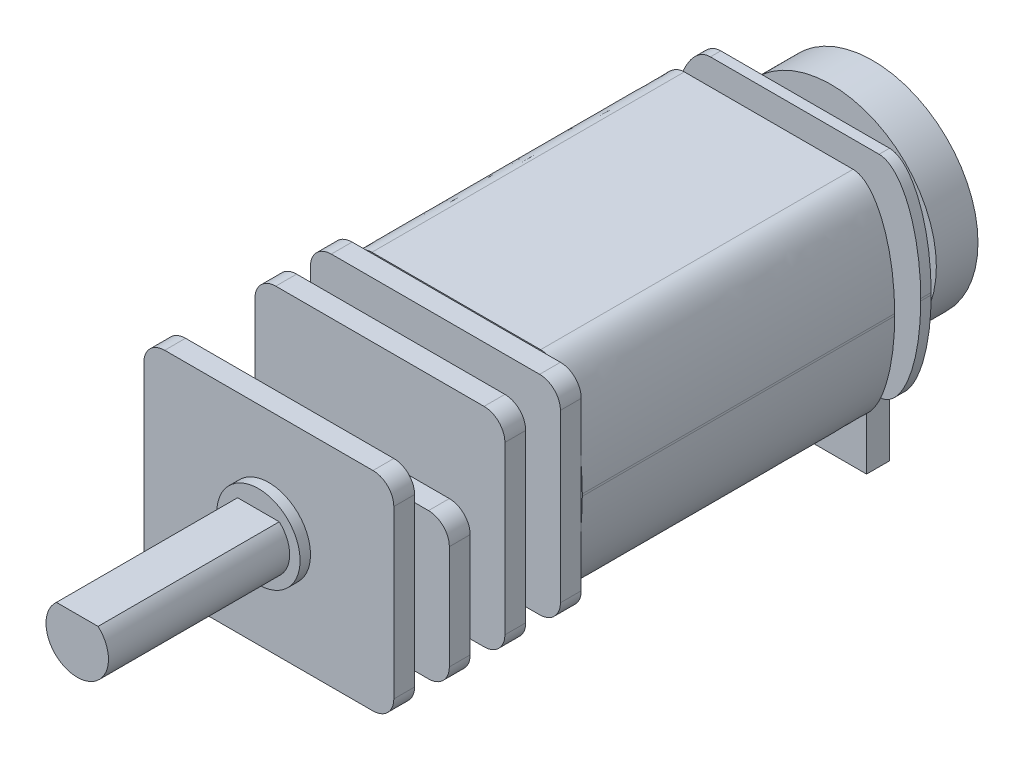
from build123d import *

# Parameters (mm, degrees)
BOSS_EXTRUDE1_DEPTH = 8.7
BOSS_EXTRUDE3_START = 8.7
SKETCH1_3_R         = 0.5
BOSS_EXTRUDE3_DEPTH = 38.2
SKETCH2_3_W         = 0.5
SKETCH2_3_H         = 10.1
BOSS_EXTRUDE4_DEPTH = 6.05
FILLET2_SIZE        = 5
FILLET2_SIZE_2      = 2
SKETCH2_W           = 1
SKETCH2_H           = 10
SKETCH2_H_2         = 7
BOSS_EXTRUDE2_DEPTH = 6
FILLET1_R           = 1
SKETCH2_5_W         = 2
SKETCH2_5_H         = 5.05
SKETCH3_R           = 2
BOSS_EXTRUDE5_DEPTH = 0.5
SKETCH4_W           = 8
SKETCH4_H           = 2.95
SKETCH4_H_2         = 1.05
BOSS_EXTRUDE6_DEPTH = 0.55


with BuildPart() as part:
    # Sketch1 → Boss-Extrude1 (new body)
    with BuildSketch(Plane.XY):
        with BuildLine():
            Line((1, 1.118033989), (-1, 1.118033989))
            ThreePointArc((-1, 1.118033989), (0, -1.5), (1, 1.118033989))
        make_face()
    extrude(amount=BOSS_EXTRUDE1_DEPTH)

    # Sketch1<3> → Boss-Extrude3 (add)
    with BuildSketch(Plane.XY.offset(BOSS_EXTRUDE3_START)):
        Circle(SKETCH1_3_R)
    extrude(amount=-BOSS_EXTRUDE3_DEPTH)

    # Sketch2<3> → Boss-Extrude4 (add, symmetric)
    with BuildSketch(Plane(origin=(0, 0, 0), x_dir=(0, 0, -1), z_dir=(1, 0, 0))):
        Polygon((9.5, 5.05), (9.5, 5), (9.5, -5), (9.5, -5.05), (24.5, -5.05), (24.5, 0), (24.5, 5.05), align=None)
        with Locations((26, 0)):
            Rectangle(SKETCH2_3_W, SKETCH2_3_H)
    extrude(amount=BOSS_EXTRUDE4_DEPTH, both=True)

    # Fillet2
    # an asymmetric fillet: 5, 2 mm, written as the material it takes off along each edge
    with BuildSketch(Plane(origin=(-6.05, -5.05, 3), x_dir=(0, 1, 0), z_dir=(0, 0, -1)), Plane(origin=(-6.05, 5.05, -37), x_dir=(0, -1, 0), z_dir=(0, 0, 1))) as fillet2_piece_1:
        with BuildLine():
            Bezier((FILLET2_SIZE, 0), (0, 0), (0, FILLET2_SIZE_2), weights=[1, 0.707106781, 1])
            Line((0, FILLET2_SIZE_2), (0, 0))
            Line((0, 0), (FILLET2_SIZE, 0))
        make_face()
    extrude(amount=40, mode=Mode.SUBTRACT)
    with BuildSketch(Plane(origin=(6.05, -5.05, 3), x_dir=(-1, 0, 0), z_dir=(0, 0, -1)), Plane(origin=(6.05, 5.05, -37), x_dir=(-1, 0, 0), z_dir=(0, 0, 1))) as fillet2_piece_2:
        with BuildLine():
            Bezier((FILLET2_SIZE_2, 0), (0, 0), (0, FILLET2_SIZE), weights=[1, 0.707106781, 1])
            Line((0, FILLET2_SIZE), (0, 0))
            Line((0, 0), (FILLET2_SIZE_2, 0))
        make_face()
    extrude(amount=40, mode=Mode.SUBTRACT)
    with BuildSketch(Plane(origin=(-6.05, -5.05, -13.25), x_dir=(0, 1, 0), z_dir=(0, 0, -1)), Plane(origin=(-6.05, 5.05, -38.75), x_dir=(0, -1, 0), z_dir=(0, 0, 1))) as fillet2_piece_3:
        with BuildLine():
            Bezier((FILLET2_SIZE, 0), (0, 0), (0, FILLET2_SIZE_2), weights=[1, 0.707106781, 1])
            Line((0, FILLET2_SIZE_2), (0, 0))
            Line((0, 0), (FILLET2_SIZE, 0))
        make_face()
    extrude(amount=25.5, mode=Mode.SUBTRACT)
    with BuildSketch(Plane(origin=(6.05, -5.05, -13.25), x_dir=(-1, 0, 0), z_dir=(0, 0, -1)), Plane(origin=(6.05, 5.05, -38.75), x_dir=(-1, 0, 0), z_dir=(0, 0, 1))) as fillet2_piece_4:
        with BuildLine():
            Bezier((FILLET2_SIZE_2, 0), (0, 0), (0, FILLET2_SIZE), weights=[1, 0.707106781, 1])
            Line((0, FILLET2_SIZE), (0, 0))
            Line((0, 0), (FILLET2_SIZE_2, 0))
        make_face()
    extrude(amount=25.5, mode=Mode.SUBTRACT)

    # Sketch2 → Boss-Extrude2 (add, symmetric)
    with BuildSketch(Plane(origin=(0, 0, 0), x_dir=(0, 0, -1), z_dir=(1, 0, 0))):
        with Locations((1, 0)):
            Rectangle(SKETCH2_W, SKETCH2_H)
        with Locations((3.666666667, -1.5)):
            Rectangle(SKETCH2_W, SKETCH2_H_2)
        with Locations((9, 0)):
            Rectangle(SKETCH2_W, SKETCH2_H)
        with Locations((6.333333333, 0)):
            Rectangle(SKETCH2_W, SKETCH2_H)
    extrude(amount=BOSS_EXTRUDE2_DEPTH, both=True)

    # Fillet1
    fillet1_edges = [part.edges().sort_by_distance(p)[0] for p in [
        (-6, 5, -1),
        (6, 5, -1),
        (-6, -5, -1),
        (-6, -5, -3.666666667),
        (-6, -5, -6.333333333),
        (-6, -5, -9),
        (-6, 5, -9),
        (-6, 5, -6.333333333),
        (-6, 2, -3.666666667),
        (6, 5, -9),
        (6, 5, -6.333333333),
        (6, 2, -3.666666667),
        (6, -5, -9),
        (6, -5, -6.333333333),
        (6, -5, -3.666666667),
        (6, -5, -1),
    ]]
    fillet(fillet1_edges, radius=FILLET1_R)

    # Sketch2<5> → Revolve1 (revolve)
    with BuildSketch(Plane(origin=(0, 0, 0), x_dir=(0, 0, -1), z_dir=(1, 0, 0))):
        with Locations((28.5, 2.525)):
            Rectangle(SKETCH2_5_W, SKETCH2_5_H)
    revolve(axis=Axis((0, 0, -27.5), (0, 0, -1)))

    # Sketch3 → Boss-Extrude5 (add)
    with BuildSketch(Plane.XY.offset(-0.5)):
        with Locations(Location((0, 0, 0), (0, 0, 180))):
            Circle(SKETCH3_R)
    extrude(amount=BOSS_EXTRUDE5_DEPTH)

    # Sketch4 → Boss-Extrude6 (add, symmetric)
    with BuildSketch(Plane.XY.offset(-25.75)):
        with Locations((0, -6.525)):
            Rectangle(SKETCH4_W, SKETCH4_H)
        with Locations((0, -4.525)):
            Rectangle(SKETCH4_W, SKETCH4_H_2)
    extrude(amount=BOSS_EXTRUDE6_DEPTH, both=True)


solid = part.part
